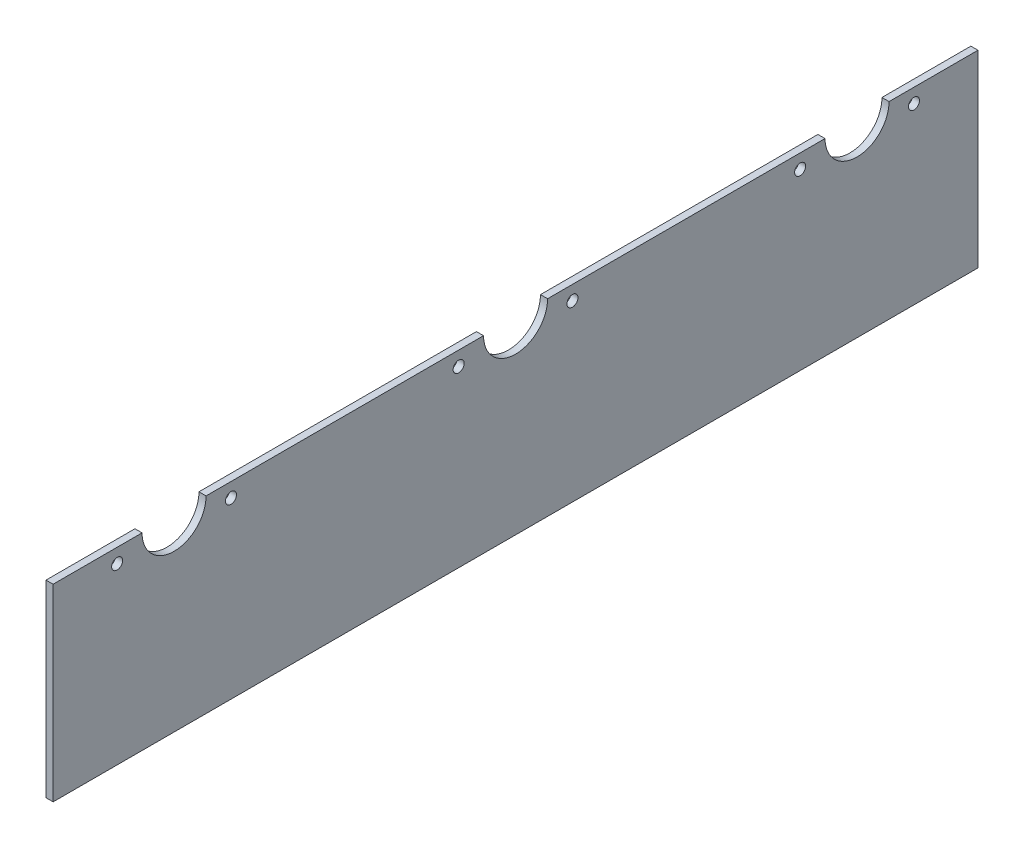
from build123d import *

# Parameters (mm, degrees)
BOSS_EXTRUDE1_DEPTH          = 3.175
F_10_0_1935_DIAMETER_HOLE1_D = 4.9149


with BuildPart() as part:
    # Sketch1 → Boss-Extrude1 (new body)
    with BuildSketch(Plane(origin=(0, 0, 0), x_dir=(0, 0, -1), z_dir=(1, 0, 0))):
        with BuildLine():
            Line((206.375, 0), (-206.375, 0))
            Line((-206.375, 0), (-206.375, 84.1375))
            Line((-206.375, 84.1375), (-166.6875, 84.1375))
            ThreePointArc((-166.6875, 84.1375), (-152.4, 69.85), (-138.1125, 84.1375))
            Line((-138.1125, 84.1375), (-14.2875, 84.1375))
            ThreePointArc((-14.2875, 84.1375), (0, 69.85), (14.2875, 84.1375))
            Line((14.2875, 84.1375), (138.1125, 84.1375))
            ThreePointArc((138.1125, 84.1375), (152.4, 69.85), (166.6875, 84.1375))
            Line((166.6875, 84.1375), (206.375, 84.1375))
            Line((206.375, 84.1375), (206.375, 0))
        make_face()
    extrude(amount=BOSS_EXTRUDE1_DEPTH)

    # #10 (0.1935) Diameter Hole1 (through all)
    with Locations(Plane(origin=(3.175, 0, 0), x_dir=(0, 0, -1), z_dir=(1, 0, 0))):
        with Locations((-177.8, 77.7875), (-127, 77.7875), (-25.4, 77.7875), (25.4, 77.7875), (127, 77.7875), (177.8, 77.7875)):
            Hole(F_10_0_1935_DIAMETER_HOLE1_D / 2)


solid = part.part
